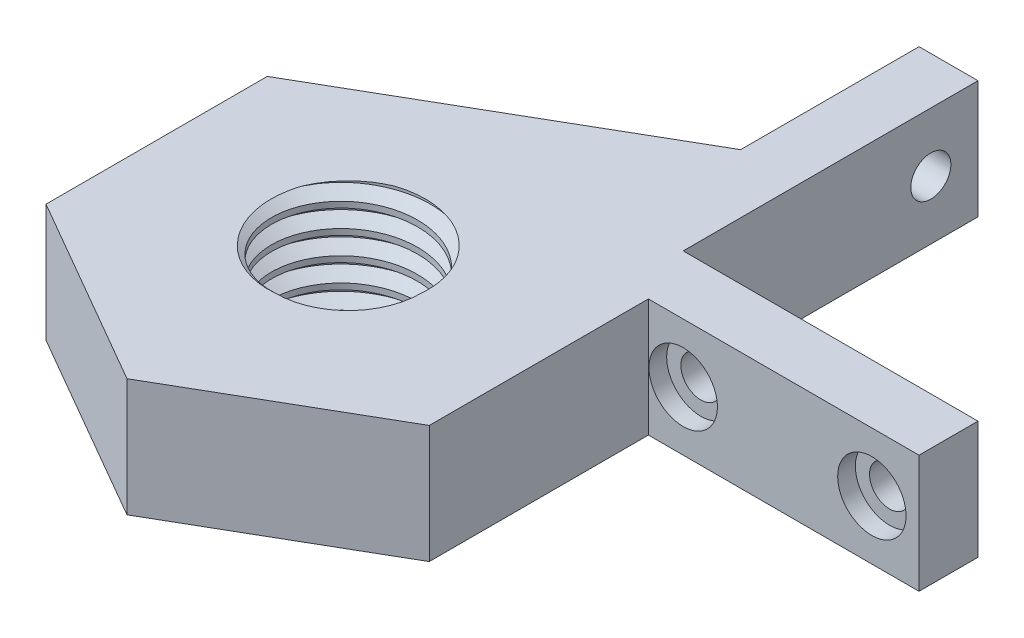
from build123d import *

# Parameters (mm, degrees)
SKIZZE1_R                       = 6.2
AUFSATZ_LINEAR_AUSTRAGEN1_DEPTH = 10
SCHNITT_LINEAR_AUSTRAGEN1_REACH = 45.9
SKIZZE3_R                       = 1.7
SKIZZE5_R                       = 2.9
SCHNITT_LINEAR_AUSTRAGEN2_DEPTH = 1.5
SCHNITT_LINEAR_AUSTRAGEN3_REACH = 47.68
SKIZZE6_R                       = 1.7
SKIZZE7_R                       = 2.9
SCHNITT_LINEAR_AUSTRAGEN4_DEPTH = 1.5
GEWINDE1_PITCH                  = 2


with BuildPart() as part:
    # Skizze1 → Aufsatz-Linear austragen1 (new body)
    with BuildSketch(Plane(origin=(0, 0, 0), x_dir=(1, 0, 0), z_dir=(0, 1, 0))):
        Polygon((0, 0), (0, 25), (-5, 25), (-5, 9.875506225), (-30.45, -4.818058126), (-30.45, -23.581941874), (-14.2, -32.963883749), (2.05, -23.581941874), (2.05, -5), (25, -5), (25, 0), align=None)
        with Locations(Location((-14.2, -14.2, 0), (0, 0, 270))):
            Circle(SKIZZE1_R, mode=Mode.SUBTRACT)
    extrude(amount=AUFSATZ_LINEAR_AUSTRAGEN1_DEPTH)

    # Skizze3 → Schnitt-Linear austragen1 (cut, up to next)
    with BuildSketch(Plane.XY.offset(5), mode=Mode.PRIVATE) as schnitt_linear_austragen1_sk1:
        with Locations((21, 5)):
            Circle(SKIZZE3_R)
    schnitt_linear_austragen1_tool1 = extrude(schnitt_linear_austragen1_sk1.sketch, amount=-SCHNITT_LINEAR_AUSTRAGEN1_REACH, mode=Mode.PRIVATE) & part.part
    # Skizze3 → Schnitt-Linear austragen1 (cut, up to next)
    with BuildSketch(Plane.XY.offset(5), mode=Mode.PRIVATE) as schnitt_linear_austragen1_sk2:
        with Locations((5, 5)):
            Circle(SKIZZE3_R)
    schnitt_linear_austragen1_tool2 = extrude(schnitt_linear_austragen1_sk2.sketch, amount=-SCHNITT_LINEAR_AUSTRAGEN1_REACH, mode=Mode.PRIVATE) & part.part
    add(schnitt_linear_austragen1_tool1.solids().sort_by_distance((21, 5, 5))[0], mode=Mode.SUBTRACT)
    add(schnitt_linear_austragen1_tool2.solids().sort_by_distance((5, 5, 5))[0], mode=Mode.SUBTRACT)

    # Skizze5 → Schnitt-Linear austragen2 (cut)
    with BuildSketch(Plane.XY.offset(5)):
        with Locations(Location((5, 5, 0), (0, 0, 180))):
            Circle(SKIZZE5_R)
        with Locations(Location((21, 5, 0), (0, 0, 180))):
            Circle(SKIZZE5_R)
    extrude(amount=-SCHNITT_LINEAR_AUSTRAGEN2_DEPTH, mode=Mode.SUBTRACT)

    # Skizze6 → Schnitt-Linear austragen3 (cut, up to next)
    with BuildSketch(Plane.ZY.offset(5), mode=Mode.PRIVATE) as schnitt_linear_austragen3_sk1:
        with Locations((-21, 5)):
            Circle(SKIZZE6_R)
    schnitt_linear_austragen3_tool1 = extrude(schnitt_linear_austragen3_sk1.sketch, amount=-SCHNITT_LINEAR_AUSTRAGEN3_REACH, mode=Mode.PRIVATE) & part.part
    add(schnitt_linear_austragen3_tool1.solids().sort_by_distance((-5, 5, -21))[0], mode=Mode.SUBTRACT)

    # Skizze7 → Schnitt-Linear austragen4 (cut)
    with BuildSketch(Plane.ZY.offset(5)):
        with Locations((-21, 5)):
            Circle(SKIZZE7_R)
    extrude(amount=-SCHNITT_LINEAR_AUSTRAGEN4_DEPTH, mode=Mode.SUBTRACT)

    # Gewinde1: the profile of Gewindeprofil1 profile screwed along a right-hand helix of 10 turns, 10 arcs to a turn; built about Z, then put on its axis
    gewinde1_z = Axis((0, 0, 0), (0, 0, 1))
    gewinde1_corners = [(6.1997, 0, -0.000173205), (7.28253175, 0, 0.624999997), (7.28253175, 0, 0.874999997), (6.1997, 0, 1.5001732)]
    with BuildLine(mode=Mode.PRIVATE) as gewinde1_profile:
        Line(gewinde1_corners[0], gewinde1_corners[1])
        Line(gewinde1_corners[1], gewinde1_corners[2])
        Line(gewinde1_corners[2], gewinde1_corners[3])
        Line(gewinde1_corners[3], gewinde1_corners[0])
    gewinde1_cap = Face(gewinde1_profile.wire())
    gewinde1_turn_angles = [0, 18, 36, 54, 72, 90, 108, 126, 144, 162, 180, 198, 216, 234, 252, 270, 288, 306, 324, 342, 360]
    gewinde1_turn_weights = [1, 0.9510565162951535, 1, 0.9510565162951535, 1, 0.9510565162951535, 1, 0.9510565162951535, 1, 0.9510565162951535, 1, 0.9510565162951535, 1, 0.9510565162951535, 1, 0.9510565162951535, 1, 0.9510565162951535, 1, 0.9510565162951535, 1]
    gewinde1_turn_rails = [Edge.make_bspline([Vector(p[0], p[1], 0).rotate(gewinde1_z, gewinde1_turn_angles[k]) / gewinde1_turn_weights[k] + Vector(0, 0, p[2] + GEWINDE1_PITCH * gewinde1_turn_angles[k] / 360) for k in range(21)], [0, 0, 0, 1, 1, 2, 2, 3, 3, 4, 4, 5, 5, 6, 6, 7, 7, 8, 8, 9, 9, 10, 10, 10], 2, gewinde1_turn_weights) for p in gewinde1_corners]
    gewinde1_turn_sides = [Face.make_surface_from_curves(gewinde1_turn_rails[p[0]], gewinde1_turn_rails[p[1]]) for p in [(0, 1), (1, 2), (2, 3), (3, 0)]]
    gewinde1 = Plane(origin=(-14.2, 15, 14.2), x_dir=(-1, 0, 0), z_dir=(0, -1, 0)) * Solid(Shell([*[p.moved(Location((0, 0, GEWINDE1_PITCH * i))) for i in range(10) for p in gewinde1_turn_sides], gewinde1_cap, gewinde1_cap.rotate(gewinde1_z, 3600).moved(Location((0, 0, GEWINDE1_PITCH * 3600 / 360)))]))
    add(gewinde1, mode=Mode.SUBTRACT)


solid = part.part
